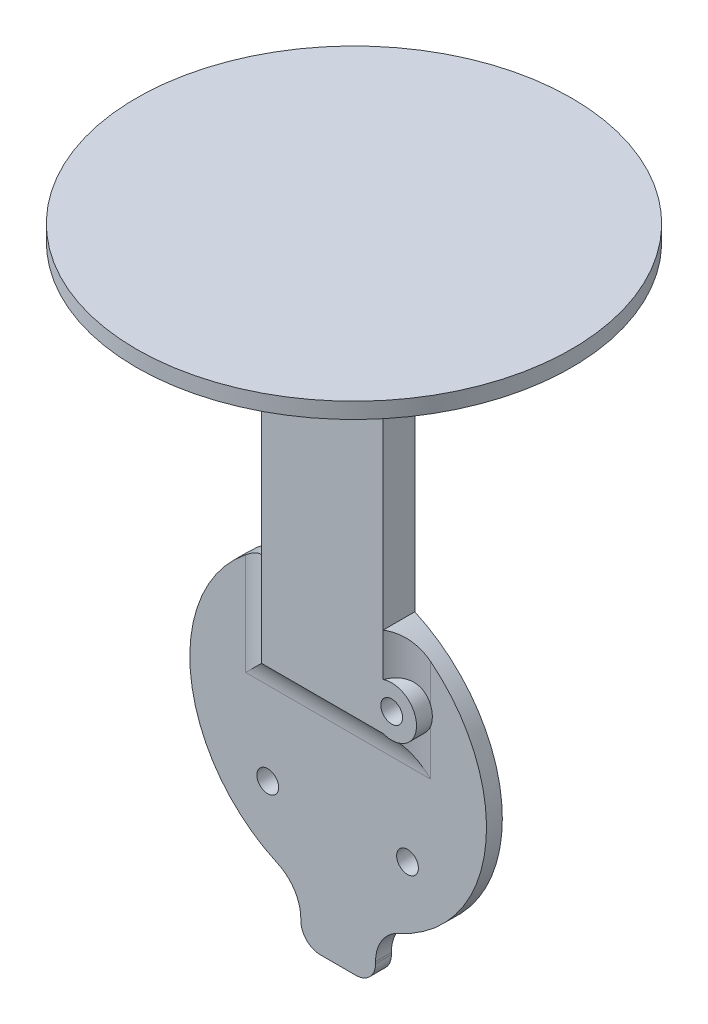
from build123d import *

# Parameters (mm, degrees)
BOSS_EXTRUDE2_DEPTH             = 4
BOSS_EXTRUDE3_DEPTH             = 4
BOSS_EXTRUDE3_DIRECTION_2_REACH = 63.707
FILLET1_R                       = 10
SKETCH4_R                       = 55
BOSS_EXTRUDE4_DEPTH             = 4
FILLET2_R                       = 15
CUT_EXTRUDE1_DEPTH              = 136.949439131
CUT_EXTRUDE1_DEPTH_BACK         = 136.949439131
SKETCH2_4_R                     = 2.75
BOSS_EXTRUDE5_START             = -4
SKETCH5_R                       = 6.283783871
SKETCH5_R_2                     = 2.75
BOSS_EXTRUDE5_DEPTH             = 4


with BuildPart() as part:
    # Sketch2 → Boss-Extrude2 (new body)
    with BuildSketch(Plane.XY):
        with BuildLine():
            Line((-9.448282852, -43.336062282), (-9.448282852, -43.842083491))
            ThreePointArc((-9.448282852, -43.842083491), (-7.983816758, -47.377617397), (-4.448282852, -48.842083491))
            Line((-4.448282852, -48.842083491), (4.448282796, -48.842083491))
            ThreePointArc((4.448282796, -48.842083491), (7.983816702, -47.377617397), (9.448282796, -43.842083491))
            Line((9.448282796, -43.842083491), (9.448282796, -43.336062307))
            ThreePointArc((9.448282796, -43.336062307), (11.053529874, -37.902083712), (15.353907471, -34.212680769))
            ThreePointArc((15.353907471, -34.212680769), (2.4e-08, 37.5), (-15.353907514, -34.212680749))
            ThreePointArc((-15.353907514, -34.212680749), (-11.053529926, -37.902083692), (-9.448282852, -43.336062282))
        make_face()
    extrude(amount=BOSS_EXTRUDE2_DEPTH)

    # Sketch3 → Boss-Extrude3 (add)
    with BuildSketch(Plane.XY.offset(4)):
        with BuildLine():
            Line((-15.37292341, 11.548994525), (15.372923459, 11.548994525))
            Line((15.372923459, 11.548994525), (15.372923459, 34.204140456))
            ThreePointArc((15.372923459, 34.204140456), (2.6e-08, 37.5), (-15.37292341, 34.204140478))
            Line((-15.37292341, 34.204140478), (-15.37292341, 11.548994525))
        make_face()
        with BuildLine():
            ThreePointArc((-15.37292341, 34.204140478), (2.6e-08, 37.5), (15.372923459, 34.204140456))
            Line((15.372923459, 34.204140456), (15.372923459, 107.5))
            Line((15.372923459, 107.5), (-15.37292341, 107.5))
            Line((-15.37292341, 107.5), (-15.37292341, 34.204140478))
        make_face()
    extrude(amount=BOSS_EXTRUDE3_DEPTH)

    # Boss-Extrude3 direction 2: up to this face of the body (flat: up to its plane)
    boss_extrude3_direction_2_end = Plane(part.part.faces().sort_by_distance((-1e-09, -2.077742583, 0))[0])
    # Sketch3 → Boss-Extrude3 direction 2 (add, up to the picked face)
    with BuildSketch(Plane.XY.offset(4), mode=Mode.PRIVATE) as boss_extrude3_direction_2_sk1:
        with BuildLine():
            Line((-15.37292341, 11.548994525), (15.372923459, 11.548994525))
            Line((15.372923459, 11.548994525), (15.372923459, 34.204140456))
            ThreePointArc((15.372923459, 34.204140456), (2.6e-08, 37.5), (-15.37292341, 34.204140478))
            Line((-15.37292341, 34.204140478), (-15.37292341, 11.548994525))
        make_face()
    boss_extrude3_direction_2_tool1 = split(extrude(boss_extrude3_direction_2_sk1.sketch, amount=-BOSS_EXTRUDE3_DIRECTION_2_REACH, mode=Mode.PRIVATE), bisect_by=boss_extrude3_direction_2_end, keep=Keep.BOTH, mode=Mode.PRIVATE)
    # Sketch3 → Boss-Extrude3 direction 2 (add, up to the picked face)
    with BuildSketch(Plane.XY.offset(4), mode=Mode.PRIVATE) as boss_extrude3_direction_2_sk2:
        with BuildLine():
            ThreePointArc((-15.37292341, 34.204140478), (2.6e-08, 37.5), (15.372923459, 34.204140456))
            Line((15.372923459, 34.204140456), (15.372923459, 107.5))
            Line((15.372923459, 107.5), (-15.37292341, 107.5))
            Line((-15.37292341, 107.5), (-15.37292341, 34.204140478))
        make_face()
    boss_extrude3_direction_2_tool2 = split(extrude(boss_extrude3_direction_2_sk2.sketch, amount=-BOSS_EXTRUDE3_DIRECTION_2_REACH, mode=Mode.PRIVATE), bisect_by=boss_extrude3_direction_2_end, keep=Keep.BOTH, mode=Mode.PRIVATE)
    add(boss_extrude3_direction_2_tool1.solids().sort_by(Axis((0, 24.004369, 4), (0, 0, -1)))[0])
    add(boss_extrude3_direction_2_tool2.solids().sort_by(Axis((0, 71.954024, 4), (0, 0, -1)))[0])

    # Fillet1
    # the kernel refuses this fillet: 10 mm, written as the material it adds along each edge
    with BuildSketch(Plane(origin=(-15.37292341, 54.204140478, 4), x_dir=(-1, 0, 0), z_dir=(0, -1, 0))) as fillet1_piece_1_section:
        with BuildLine():
            CenterArc((8, -10), FILLET1_R, 90, 53.130102354)
            Line((0, -4), (-0.16, -3.88))
            ThreePointArc((-0.16, -3.88), (-0.2, -2), (-0.2, 0))
            Line((-0.2, 0), (0, 0.2))
            Line((0, 0.2), (8, 0.2))
            Line((8, 0.2), (8, 0))
        make_face()
    fillet1_piece_1 = extrude(amount=42.655145953, mode=Mode.PRIVATE)
    fillet1_piece_1 = fillet1_piece_1 & Plane(origin=(0, 0, 5.050776903), x_dir=(0.4094375325494367, -0.9123381538332315, 0), z_dir=(0, 0, -1)) * Cylinder(37.5, 118, mode=Mode.PRIVATE)
    add(fillet1_piece_1)
    with BuildSketch(Plane(origin=(-15.37292341, 11.548994525, 4), x_dir=(0, -1, 0), z_dir=(1, 0, 0))) as fillet1_piece_2:
        with BuildLine():
            CenterArc((8, -10), FILLET1_R, 90, 53.130102354)
            Line((0, -4), (-0.16, -3.88))
            ThreePointArc((-0.16, -3.88), (-0.2, -2), (-0.2, 0))
            Line((-0.2, 0), (0, 0.2))
            Line((0, 0.2), (8, 0.2))
            Line((8, 0.2), (8, 0))
        make_face()
    extrude(amount=30.745846869)
    with BuildSketch(Plane(origin=(15.372923459, 54.204140456, 4), x_dir=(1, 0, 0), z_dir=(0, -1, 0))) as fillet1_piece_3_section:
        with BuildLine():
            CenterArc((8, 10), FILLET1_R, 216.869897646, 53.130102354)
            Line((0, 4), (-0.16, 3.88))
            ThreePointArc((-0.16, 3.88), (-0.2, 2), (-0.2, 0))
            Line((-0.2, 0), (0, -0.2))
            Line((0, -0.2), (8, -0.2))
            Line((8, -0.2), (8, 0))
        make_face()
    fillet1_piece_3 = extrude(amount=42.655145931, mode=Mode.PRIVATE)
    fillet1_piece_3 = fillet1_piece_3 & Plane(origin=(0, 0, 5.050777143), x_dir=(0.4094375325494367, -0.9123381538332315, 0), z_dir=(0, 0, -1)) * Cylinder(37.5, 118, mode=Mode.PRIVATE)
    add(fillet1_piece_3)
    with BuildSketch(Plane(origin=(-15.37292341, 54.204140478, 4), x_dir=(-1, 0, 0), z_dir=(0, -1, 0))) as fillet1_piece_4a_section:
        with BuildLine():
            CenterArc((8, -10), FILLET1_R, 90, 53.130102354)
            Line((0, -4), (-0.16, -3.88))
            ThreePointArc((-0.16, -3.88), (-0.2, -2), (-0.2, 0))
            Line((-0.2, 0), (0, 0.2))
            Line((0, 0.2), (8, 0.2))
            Line((8, 0.2), (8, 0))
        make_face()
    fillet1_piece_4a = extrude(amount=62.655145953, mode=Mode.PRIVATE)
    fillet1_piece_4a = split(fillet1_piece_4a, bisect_by=Plane(origin=(-17.431757525, 11.548994525, 5.023885124), z_dir=(0, -1, 0)), keep=Keep.TOP, mode=Mode.PRIVATE)
    with BuildSketch(Plane(origin=(-35.37292341, 11.548994525, 4), x_dir=(0, -1, 0), z_dir=(1, 0, 0))) as fillet1_piece_4b_section:
        with BuildLine():
            CenterArc((8, -10), FILLET1_R, 90, 53.130102354)
            Line((0, -4), (-0.16, -3.88))
            ThreePointArc((-0.16, -3.88), (-0.2, -2), (-0.2, 0))
            Line((-0.2, 0), (0, 0.2))
            Line((0, 0.2), (8, 0.2))
            Line((8, 0.2), (8, 0))
        make_face()
    fillet1_piece_4b = extrude(amount=50.745846869, mode=Mode.PRIVATE)
    fillet1_piece_4b = split(fillet1_piece_4b, bisect_by=Plane(origin=(-15.37292341, 9.490160411, 5.023885124), z_dir=(-1, 0, 0)), keep=Keep.TOP, mode=Mode.PRIVATE)
    fillet1_piece_4 = fillet1_piece_4a & fillet1_piece_4b
    add(fillet1_piece_4)
    with BuildSketch(Plane(origin=(-15.37292341, 11.548994525, 4), x_dir=(0, -1, 0), z_dir=(1, 0, 0))) as fillet1_piece_5a_section:
        with BuildLine():
            CenterArc((8, -10), FILLET1_R, 90, 53.130102354)
            Line((0, -4), (-0.16, -3.88))
            ThreePointArc((-0.16, -3.88), (-0.2, -2), (-0.2, 0))
            Line((-0.2, 0), (0, 0.2))
            Line((0, 0.2), (8, 0.2))
            Line((8, 0.2), (8, 0))
        make_face()
    fillet1_piece_5a = extrude(amount=50.745846869, mode=Mode.PRIVATE)
    fillet1_piece_5a = split(fillet1_piece_5a, bisect_by=Plane(origin=(15.372923459, 9.490160411, 5.023885124), z_dir=(1, 0, 0)), keep=Keep.TOP, mode=Mode.PRIVATE)
    with BuildSketch(Plane(origin=(15.372923459, 54.204140456, 4), x_dir=(1, 0, 0), z_dir=(0, -1, 0))) as fillet1_piece_5b_section:
        with BuildLine():
            CenterArc((8, 10), FILLET1_R, 216.869897646, 53.130102354)
            Line((0, 4), (-0.16, 3.88))
            ThreePointArc((-0.16, 3.88), (-0.2, 2), (-0.2, 0))
            Line((-0.2, 0), (0, -0.2))
            Line((0, -0.2), (8, -0.2))
            Line((8, -0.2), (8, 0))
        make_face()
    fillet1_piece_5b = extrude(amount=62.655145931, mode=Mode.PRIVATE)
    fillet1_piece_5b = split(fillet1_piece_5b, bisect_by=Plane(origin=(17.431757573, 11.548994525, 5.023885124), z_dir=(0, -1, 0)), keep=Keep.TOP, mode=Mode.PRIVATE)
    fillet1_piece_5 = fillet1_piece_5a & fillet1_piece_5b
    add(fillet1_piece_5)

    # Sketch4 → Boss-Extrude4 (add)
    with BuildSketch(Plane(origin=(0, 107.5, 0), x_dir=(1, 0, 0), z_dir=(0, 1, 0))):
        with Locations(Location((0, 0, 0), (0, 0, 270))):
            Circle(SKETCH4_R)
    extrude(amount=BOSS_EXTRUDE4_DEPTH)

    # Fillet2
    fillet2_edges = [part.edges().sort_by_distance(p)[0] for p in [
        (15.372923459, 107.5, 4),
        (-15.37292341, 107.5, 4),
        (2.4e-08, 107.5, 0),
        (2.4e-08, 107.5, 8),
    ]]
    fillet(fillet2_edges, radius=FILLET2_R)

    # Sketch2<4> → Cut-Extrude1 (cut, two sides: drawn at the far end of the back side and taken through both)
    with BuildSketch(Plane.XY.offset(-CUT_EXTRUDE1_DEPTH_BACK)):
        with Locations((17.525184131, 17.452697917)):
            Circle(SKETCH2_4_R)
        with Locations((17.525184131, -17.473883919)):
            Circle(SKETCH2_4_R)
        with Locations((-17.804632122, -17.473883919)):
            Circle(SKETCH2_4_R)
    extrude(amount=CUT_EXTRUDE1_DEPTH + CUT_EXTRUDE1_DEPTH_BACK, mode=Mode.SUBTRACT)

    # Sketch5 → Boss-Extrude5 (add)
    with BuildSketch(Plane.XY.offset(8).offset(BOSS_EXTRUDE5_START)):
        with Locations((17.525184131, 17.452697917)):
            Circle(SKETCH5_R)
        with Locations((17.525184131, 17.452697917)):
            Circle(SKETCH5_R_2, mode=Mode.SUBTRACT)
    extrude(amount=BOSS_EXTRUDE5_DEPTH)


solid = part.part
